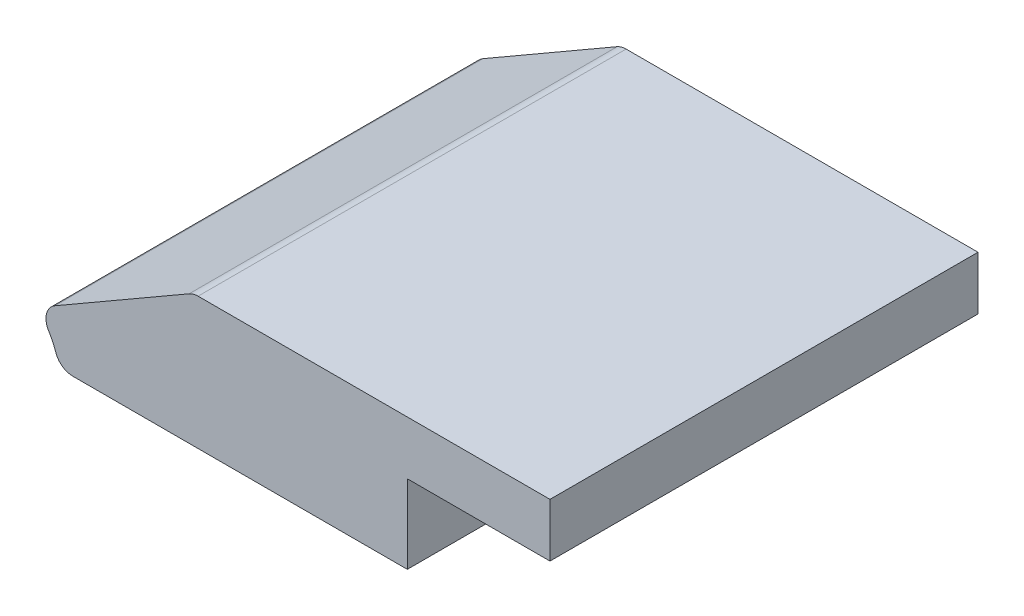
from build123d import *

# Parameters (mm, degrees)
BOSS_EXTRUDE1_DEPTH = 76.2
FILLET1_R           = 3.175


with BuildPart() as part:
    # Sketch1 → Boss-Extrude1 (new body)
    with BuildSketch(Plane.XY):
        with BuildLine():
            Line((8.64018457, 9.307911183), (36.5125, 25.4))
            Line((36.5125, 25.4), (100.0125, 25.4))
            Line((100.0125, 25.4), (100.0125, 15.875))
            Line((100.0125, 15.875), (74.6125, 15.875))
            Line((74.6125, 15.875), (74.6125, 1.905))
            Line((74.6125, 1.905), (12.556312158, 1.905))
            ThreePointArc((12.556312158, 1.905), (11.226025204, 5.938548486), (8.64018457, 9.307911183))
        make_face()
    extrude(amount=BOSS_EXTRUDE1_DEPTH)

    # Fillet1
    fillet1_edges = [part.edges().sort_by_distance(p)[0] for p in [
        (36.5125, 25.4, 38.1),
        (12.556312158, 1.905, 38.1),
        (8.64018457, 9.307911183, 38.1),
    ]]
    fillet(fillet1_edges, radius=FILLET1_R)


solid = part.part
